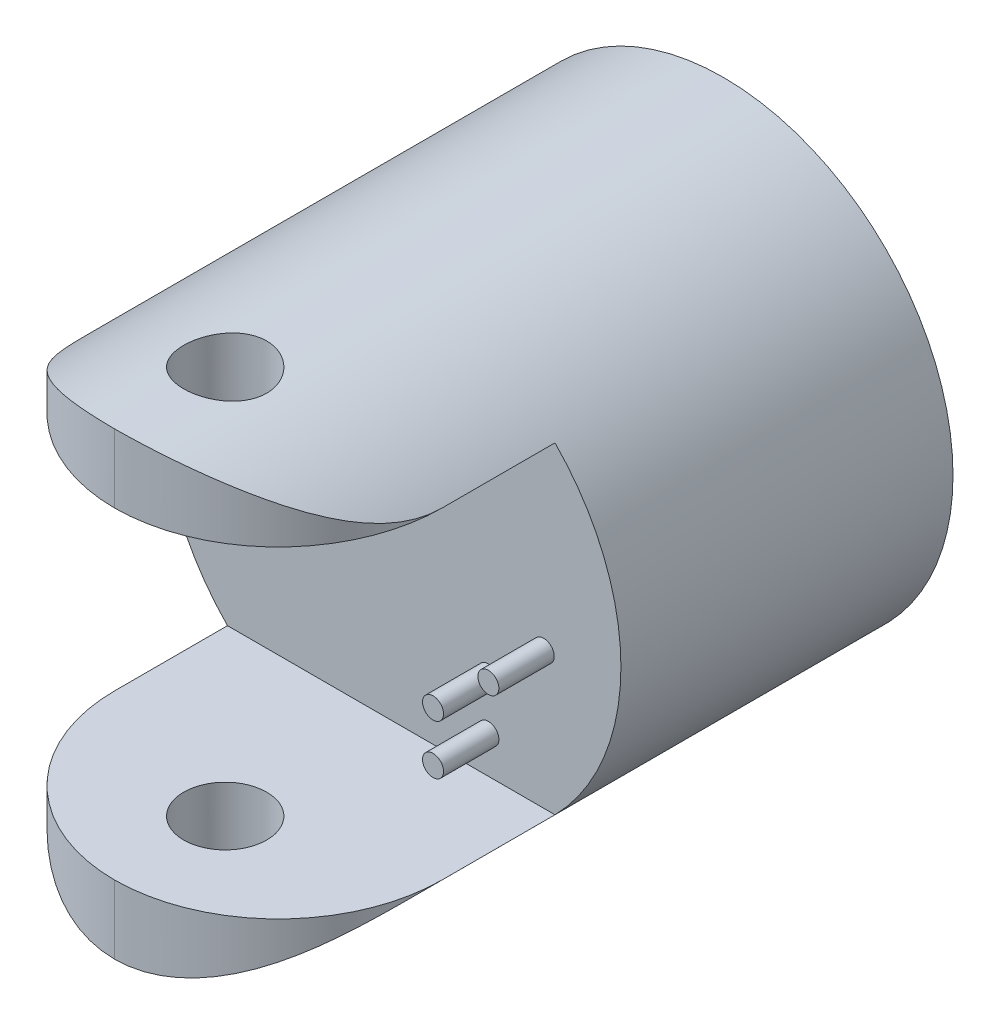
from build123d import *

# Parameters (mm, degrees)
SKETCH1_R               = 4.15
BOSS_EXTRUDE1_DEPTH     = 11
SKETCH2_W               = 8.37511106
SKETCH2_H               = 5.82
CUT_EXTRUDE1_DEPTH      = 5
CUT_EXTRUDE2_DEPTH      = 13.467758419
CUT_EXTRUDE3_DEPTH      = 13.467758574
CUT_EXTRUDE3_DEPTH_BACK = 13.467758574
SKETCH4_R               = 0.75
SKETCH5_R               = 0.19
BOSS_EXTRUDE2_DEPTH     = 1


with BuildPart() as part:
    # Sketch1 → Boss-Extrude1 (new body)
    with BuildSketch(Plane.XY):
        Circle(SKETCH1_R)
    extrude(amount=BOSS_EXTRUDE1_DEPTH)

    # Sketch2 → Cut-Extrude1 (cut)
    with BuildSketch(Plane.XY.offset(11)):
        Rectangle(SKETCH2_W, SKETCH2_H)
    extrude(amount=-CUT_EXTRUDE1_DEPTH, mode=Mode.SUBTRACT)

    # Sketch3 → Cut-Extrude2 (cut, symmetric)
    with BuildSketch(Plane(origin=(0, 0, 0), x_dir=(1, 0, 0), z_dir=(0, 1, 0))):
        with BuildLine():
            Line((-2.958783534, -8.031414478), (-2.958783534, -11))
            Line((-2.958783534, -11), (0, -11))
            ThreePointArc((0, -11), (-2.092768611, -10.127058771), (-2.958783534, -8.031414478))
        make_face()
    cut_extrude2 = extrude(amount=CUT_EXTRUDE2_DEPTH, both=True, mode=Mode.SUBTRACT)

    # Mirror1: Cut-Extrude2 across plane
    add(cut_extrude2.mirror(Plane(origin=(0, 0, 0), x_dir=(0, 0, 1), z_dir=(1, 0, 0))), mode=Mode.SUBTRACT)

    # Sketch4 → Cut-Extrude3 (cut, two sides: drawn at the far end of the back side and taken through both)
    with BuildSketch(Plane(origin=(0, 0, 0), x_dir=(1, 0, 0), z_dir=(0, 1, 0)).offset(-CUT_EXTRUDE3_DEPTH_BACK)):
        with Locations((0, -9)):
            Circle(SKETCH4_R)
    extrude(amount=CUT_EXTRUDE3_DEPTH + CUT_EXTRUDE3_DEPTH_BACK, mode=Mode.SUBTRACT)

    # Sketch5 → Boss-Extrude2 (add)
    with BuildSketch(Plane.XY.offset(6)):
        with Locations((-1.755, 2.26)):
            Circle(SKETCH5_R)
        with Locations((-1.755, 1.36)):
            Circle(SKETCH5_R)
        with Locations((1.755, -1.34)):
            Circle(SKETCH5_R)
        with Locations((1.755, -2.24)):
            Circle(SKETCH5_R)
        with Locations((-2.755, 0.46)):
            Circle(SKETCH5_R)
        with Locations((2.755, -0.44)):
            Circle(SKETCH5_R)
    extrude(amount=BOSS_EXTRUDE2_DEPTH)


solid = part.part
